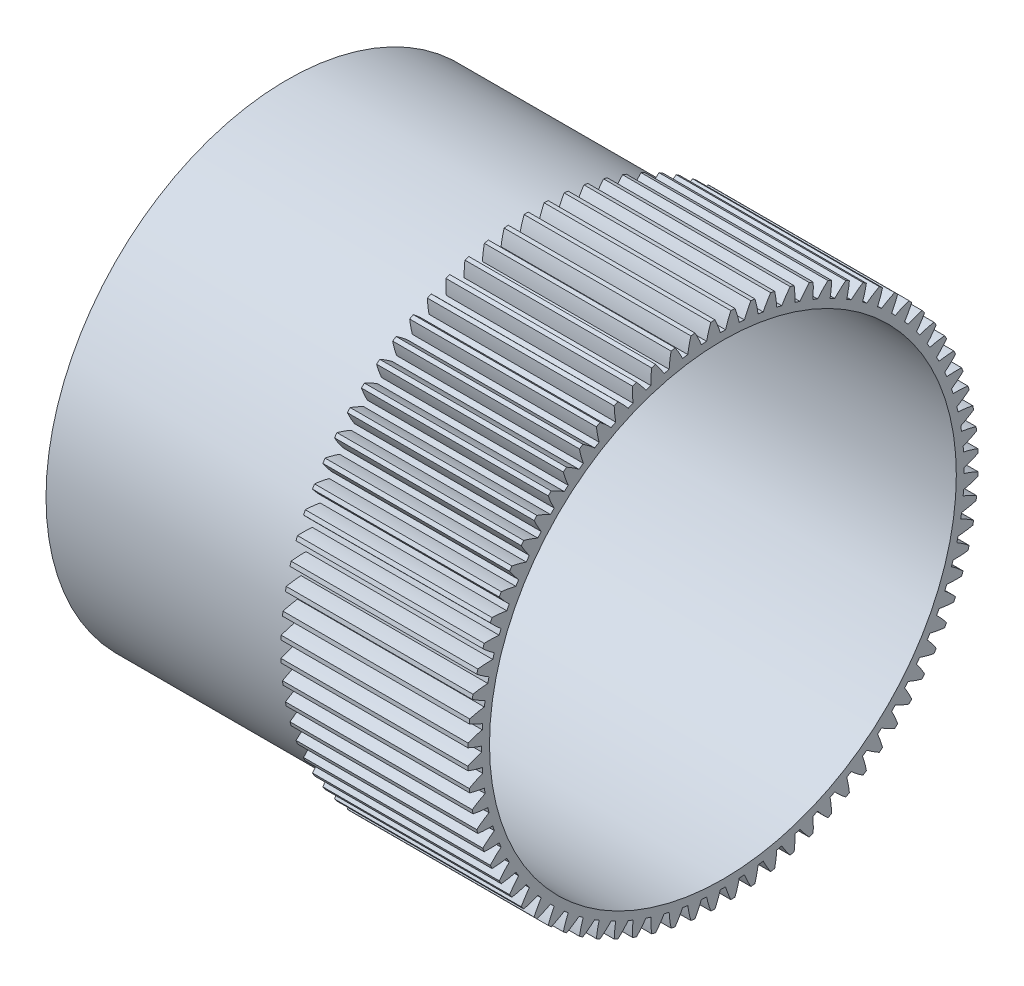
from build123d import *
from build123d.topology import SkipClean

# Parameters (mm, degrees)
BASPROSKE_W         = 15
BASPROSKE_H         = 20.5
TOOTHCUT_DEPTH      = 33.641997488
TEETHCUTS_COUNT     = 80
TEETHCUTS_ANGLE     = 355.5
BORSKE_R            = 0.5
BORE_DEPTH          = 50.0013208
SKETCH1_R           = 18.75
CUT_EXTRUDE1_DEPTH  = 33.629446803
BOSS_EXTRUDE5_START = 20
SKETCH4_R           = 19.374
SKETCH4_R_2         = 18.75
BOSS_EXTRUDE5_DEPTH = 20
SKETCH5_R           = 18.75
BOSS_EXTRUDE6_DEPTH = 1
SKETCH6_R           = 2
BOSS_EXTRUDE7_DEPTH = 10


with BuildPart() as part:
    # BasProSke → Base-Revolve (revolve)
    with BuildSketch(Plane(origin=(0, 0, 0), x_dir=(1, 0, 0), z_dir=(0, 1, 0))):
        with Locations((7.5, 10.25)):
            Rectangle(BASPROSKE_W, BASPROSKE_H)
    revolve(axis=Axis((-10, 0, 0), (1, 0, 0)))

    # TooCutSke → ToothCut (cut, through all)
    with BuildSketch(Plane(origin=(0, 0, 0), x_dir=(0, 0, -1), z_dir=(1, 0, 0))):
        with BuildLine():
            ThreePointArc((0.210127665, 19.372860459), (0, 19.374), (-0.210127665, 19.372860459))
            ThreePointArc((-0.210127665, 19.372860459), (-0.409130222, 19.952418525), (-0.651908556, 20.515044733))
            ThreePointArc((-0.651908556, 20.515044733), (0, 20.5254), (0.651908556, 20.515044733))
            ThreePointArc((0.651908556, 20.515044733), (0.409130222, 19.952418525), (0.210127665, 19.372860459))
        make_face()
    toothcut = extrude(amount=TOOTHCUT_DEPTH, mode=Mode.SUBTRACT)

    # TeethCuts: ToothCut ×80 about axis
    teethcuts_axis = Axis((-10, 0, 0), (1, 0, 0))
    for i in range(1, TEETHCUTS_COUNT):
        add(toothcut.rotate(teethcuts_axis, i * TEETHCUTS_ANGLE / (TEETHCUTS_COUNT - 1)), mode=Mode.SUBTRACT)

    # BorSke → Bore (cut, symmetric)
    with BuildSketch(Plane(origin=(0, 0, 0), x_dir=(0, 0, -1), z_dir=(1, 0, 0))):
        Circle(BORSKE_R)
    extrude(amount=BORE_DEPTH, both=True, mode=Mode.SUBTRACT)

    # Sketch1 → Cut-Extrude1 (cut, through all)
    with BuildSketch(Plane(origin=(15, 0, 0), x_dir=(0, 0, -1), z_dir=(1, 0, 0))):
        Circle(SKETCH1_R)
    extrude(amount=-CUT_EXTRUDE1_DEPTH, mode=Mode.SUBTRACT)

    # Sketch4 → Boss-Extrude5 (add)
    with SkipClean():  # the faces are left unmerged after this step: merging them gives an invalid solid
        with BuildSketch(Plane.ZY.offset(BOSS_EXTRUDE5_START)):
            Circle(SKETCH4_R)
            Circle(SKETCH4_R_2, mode=Mode.SUBTRACT)
        extrude(amount=-BOSS_EXTRUDE5_DEPTH)

    # Sketch5 → Boss-Extrude6 (add)
    with SkipClean():  # the faces are left unmerged after this step: merging them gives an invalid solid
        with BuildSketch(Plane.ZY.offset(20)):
            Circle(SKETCH5_R)
        extrude(amount=-BOSS_EXTRUDE6_DEPTH)

    # Sketch6 → Boss-Extrude7 (add)
    with SkipClean():  # the faces are left unmerged after this step: merging them gives an invalid solid
        with BuildSketch(Plane.ZY.offset(20)):
            Circle(SKETCH6_R)
        extrude(amount=BOSS_EXTRUDE7_DEPTH)


solid = part.part
